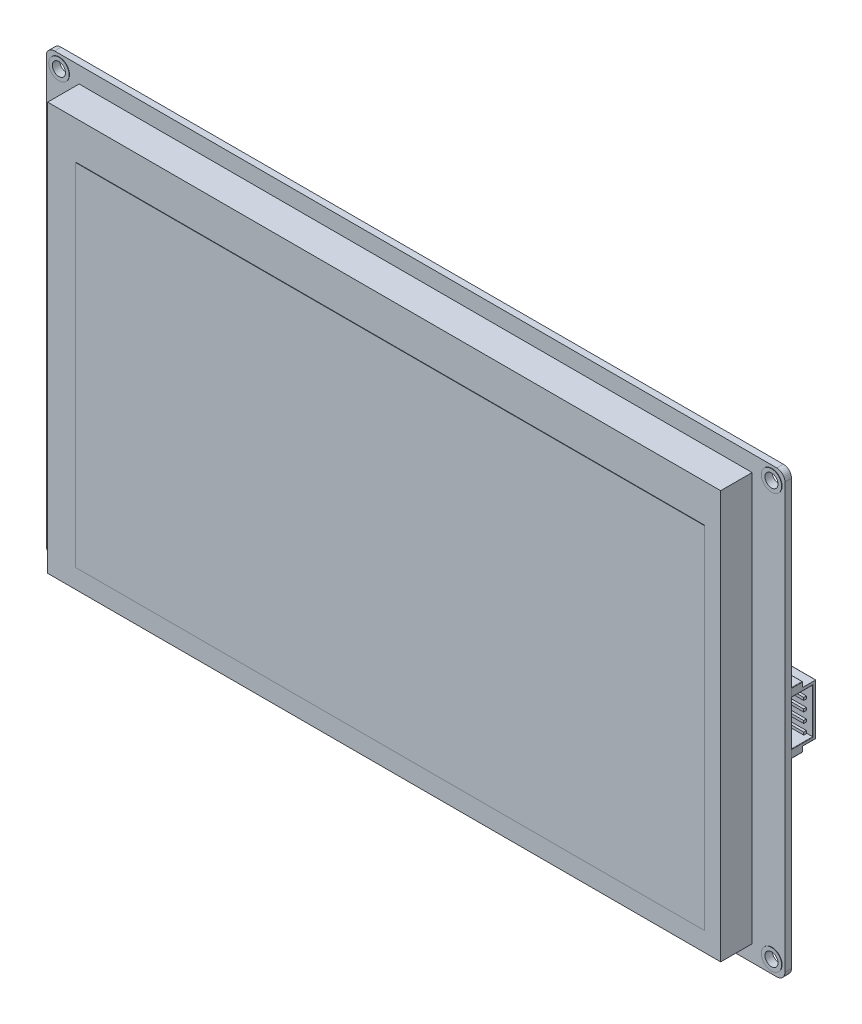
from build123d import *

# Parameters (mm, degrees)
IZIM1_W                          = 181
IZIM1_H                          = 108
Y_KSEKLIK_EKSTR_ZYON1_DEPTH      = 1.6
IZIM2_R                          = 1.6
KES_EKSTR_ZYON1_DEPTH            = 69.6
Y_KSEKLIK_EKSTR_ZYON3_DEPTH      = 0.1
Y_KSEKLIK_EKSTR_ZYON3_DEPTH_BACK = 1.7
IZIM3_R                          = 2.5
IZIM3_R_2                        = 1.6
RADYUS1_R                        = 2
IZIM4_W                          = 164.9
IZIM4_H                          = 100
Y_KSEKLIK_EKSTR_ZYON4_DEPTH      = 7.7
IZIM5_W                          = 154.08
IZIM5_H                          = 85.92
Y_KSEKLIK_EKSTR_ZYON5_DEPTH      = 0.1
IZIM9_W                          = 8.2
IZIM9_H                          = 6.25
Y_KSEKLIK_EKSTR_ZYON9_DEPTH      = 6
IZIM10_W                         = 5.25
IZIM10_H                         = 1.25
Y_KSEKLIK_EKSTR_ZYON10_DEPTH     = 2.75
KES_EKSTR_ZYON3_DEPTH            = 11.75
IZIM12_W                         = 0.504327867
IZIM12_H                         = 12.5
Y_KSEKLIK_EKSTR_ZYON11_DEPTH     = 6
Y_KSEKLIK_EKSTR_ZYON12_DEPTH     = 0.001
IZIM14_W                         = 0.65
IZIM14_H                         = 0.65
Y_KSEKLIK_EKSTR_ZYON13_DEPTH     = 7.696672133
RADYUS2_R                        = 0.1


with BuildPart() as part:
    # Çizim1 → Yükseklik-Ekstrüzyon1 (new body)
    with BuildSketch(Plane.XY):
        with Locations((90.5, -54)):
            Rectangle(IZIM1_W, IZIM1_H)
    extrude(amount=Y_KSEKLIK_EKSTR_ZYON1_DEPTH)

    # Çizim2 → Kes-Ekstrüzyon1 (cut)
    with BuildSketch(Plane.XY.offset(1.6)):
        with Locations((3.2, -3.2)):
            Circle(IZIM2_R)
        with Locations((177.8, -3.2)):
            Circle(IZIM2_R)
        with Locations((177.8, -104.8)):
            Circle(IZIM2_R)
        with Locations((3.2, -104.8)):
            Circle(IZIM2_R)
    extrude(amount=-KES_EKSTR_ZYON1_DEPTH, mode=Mode.SUBTRACT)

    # Çizim3 → Yükseklik-Ekstrüzyon3 (add, two sides: drawn at the far end of the back side and taken through both)
    # profile 1 of 4: a face of its own
    with BuildSketch(Plane.XY.offset(1.6).offset(-Y_KSEKLIK_EKSTR_ZYON3_DEPTH_BACK)):
        with Locations((3.2, -3.2)):
            Circle(IZIM3_R)
        with Locations((3.2, -3.2)):
            Circle(IZIM3_R_2, mode=Mode.SUBTRACT)
    # profile 2 of 4: a face of its own
    with BuildSketch(Plane.XY.offset(1.6).offset(-Y_KSEKLIK_EKSTR_ZYON3_DEPTH_BACK)):
        with Locations((177.8, -3.2)):
            Circle(IZIM3_R)
        with Locations((177.8, -3.2)):
            Circle(IZIM3_R_2, mode=Mode.SUBTRACT)
    # profile 3 of 4: a face of its own
    with BuildSketch(Plane.XY.offset(1.6).offset(-Y_KSEKLIK_EKSTR_ZYON3_DEPTH_BACK)):
        with Locations((3.2, -104.8)):
            Circle(IZIM3_R)
        with Locations((3.2, -104.8)):
            Circle(IZIM3_R_2, mode=Mode.SUBTRACT)
    # profile 4 of 4: a face of its own
    with BuildSketch(Plane.XY.offset(1.6).offset(-Y_KSEKLIK_EKSTR_ZYON3_DEPTH_BACK)):
        with Locations((177.8, -104.8)):
            Circle(IZIM3_R)
        with Locations((177.8, -104.8)):
            Circle(IZIM3_R_2, mode=Mode.SUBTRACT)
    extrude(amount=Y_KSEKLIK_EKSTR_ZYON3_DEPTH + Y_KSEKLIK_EKSTR_ZYON3_DEPTH_BACK)

    # Radyus1
    radyus1_edges = [part.edges().sort_by_distance(p)[0] for p in [
        (0, 0, 0.8),
        (181, 0, 0.8),
        (181, -108, 0.8),
        (0, -108, 0.8),
    ]]
    fillet(radyus1_edges, radius=RADYUS1_R)

    # Çizim4 → Yükseklik-Ekstrüzyon4 (add)
    with BuildSketch(Plane.XY.offset(1.6)):
        with Locations((90.5, -54)):
            Rectangle(IZIM4_W, IZIM4_H)
    extrude(amount=Y_KSEKLIK_EKSTR_ZYON4_DEPTH)

    # Çizim5 → Yükseklik-Ekstrüzyon5 (add)
    with BuildSketch(Plane.XY.offset(9.3)):
        with Locations((91.99, -56.26)):
            Rectangle(IZIM5_W, IZIM5_H)
    extrude(amount=Y_KSEKLIK_EKSTR_ZYON5_DEPTH)

    # Çizim9 → Yükseklik-Ekstrüzyon9 (add)
    with BuildSketch(Plane(origin=(0, 0, 0), x_dir=(-1, 0, 0), z_dir=(0, 0, -1))):
        with Locations((-176.9, -50.875)):
            Rectangle(IZIM9_W, IZIM9_H)
        with Locations((-176.9, -57.125)):
            Rectangle(IZIM9_W, IZIM9_H)
    extrude(amount=Y_KSEKLIK_EKSTR_ZYON9_DEPTH)

    # Çizim10 → Yükseklik-Ekstrüzyon10 (add)
    with BuildSketch(Plane(origin=(0, 0, 0), x_dir=(-1, 0, 0), z_dir=(0, 0, -1))):
        with Locations((-178.375, -60.875)):
            Rectangle(IZIM10_W, IZIM10_H)
        with Locations((-178.375, -47.125)):
            Rectangle(IZIM10_W, IZIM10_H)
    extrude(amount=Y_KSEKLIK_EKSTR_ZYON10_DEPTH)

    # Çizim11 → Kes-Ekstrüzyon3 (cut)
    with BuildSketch(Plane(origin=(181, 0, 0), x_dir=(0, 0, -1), z_dir=(1, 0, 0))):
        Polygon((5.25, -48.5), (0, -48.5), (0, -59.5), (2, -59.5), (5.25, -59.5), align=None)
    extrude(amount=-KES_EKSTR_ZYON3_DEPTH, mode=Mode.SUBTRACT)

    # Çizim12 → Yükseklik-Ekstrüzyon11 (add)
    with BuildSketch(Plane(origin=(0, 0, -6), x_dir=(-1, 0, 0), z_dir=(0, 0, -1))):
        with Locations((-173.052163934, -54)):
            Rectangle(IZIM12_W, IZIM12_H)
    extrude(amount=-Y_KSEKLIK_EKSTR_ZYON11_DEPTH)

    # Çizim13 → Yükseklik-Ekstrüzyon12 (add)
    with BuildSketch(Plane(origin=(181, 0, 0), x_dir=(0, 0, -1), z_dir=(1, 0, 0))):
        Polygon((0, -59.5), (0, -61.5), (2.75, -61.5), (2.75, -60.25), (6, -60.25), (6, -47.75), (2.75, -47.75), (2.75, -46.5), (0, -46.5), (0, -48.5), (5.25, -48.5), (5.25, -59.5), align=None)
    extrude(amount=Y_KSEKLIK_EKSTR_ZYON12_DEPTH)

    # Çizim14 → Yükseklik-Ekstrüzyon13 (add)
    with BuildSketch(Plane(origin=(173.304327867, 0, 0), x_dir=(0, 0, -1), z_dir=(1, 0, 0))):
        with Locations((3.325, -57.675)):
            Rectangle(IZIM14_W, IZIM14_H)
        with Locations((3.325, -55.225)):
            Rectangle(IZIM14_W, IZIM14_H)
        with Locations((3.325, -52.775)):
            Rectangle(IZIM14_W, IZIM14_H)
        with Locations((3.325, -50.325)):
            Rectangle(IZIM14_W, IZIM14_H)
    extrude(amount=Y_KSEKLIK_EKSTR_ZYON13_DEPTH)

    # Radyus2
    # the kernel refuses this fillet: 0.1 mm, written as the material it takes off along each edge
    with BuildSketch(Plane(origin=(175.85, -61.4, -2.65), x_dir=(0, 0, -1), z_dir=(-1, 0, 0))) as radyus2_piece_1_section:
        Polygon((0, 0), (RADYUS2_R * 1.02, 0), (RADYUS2_R * 1.02, RADYUS2_R * 1.02), (0, RADYUS2_R * 1.02), align=None)
    radyus2_piece_1 = extrude(amount=RADYUS2_R * 1.02, mode=Mode.PRIVATE)
    radyus2_piece_1 = radyus2_piece_1 - Plane(origin=(175.85, -61.4, -2.65), x_dir=(0, 0.7071067811865475, 0.7071067811865475), z_dir=(-1, 0, 0)) * Sphere(RADYUS2_R, mode=Mode.PRIVATE)
    add(radyus2_piece_1, mode=Mode.SUBTRACT)
    with BuildSketch(Plane(origin=(172.9, -60.15, -5.9), x_dir=(0, 0, -1), z_dir=(-1, 0, 0))) as radyus2_piece_2_section:
        Polygon((0, 0), (RADYUS2_R * 1.02, 0), (RADYUS2_R * 1.02, RADYUS2_R * 1.02), (0, RADYUS2_R * 1.02), align=None)
    radyus2_piece_2 = extrude(amount=RADYUS2_R * 1.02, mode=Mode.PRIVATE)
    radyus2_piece_2 = radyus2_piece_2 - Plane(origin=(172.9, -60.15, -5.9), x_dir=(0, 0.7071067811865475, 0.7071067811865475), z_dir=(-1, 0, 0)) * Sphere(RADYUS2_R, mode=Mode.PRIVATE)
    add(radyus2_piece_2, mode=Mode.SUBTRACT)
    with BuildSketch(Plane(origin=(172.9, -47.85, -5.9), x_dir=(-1, 0, 0), z_dir=(0, 1, 0))) as radyus2_piece_3_section:
        Polygon((0, 0), (RADYUS2_R * 1.02, 0), (RADYUS2_R * 1.02, -RADYUS2_R * 1.02), (0, -RADYUS2_R * 1.02), align=None)
    radyus2_piece_3 = extrude(amount=RADYUS2_R * 1.02, mode=Mode.PRIVATE)
    radyus2_piece_3 = radyus2_piece_3 - Plane(origin=(172.9, -47.85, -5.9), x_dir=(0.7071067811865475, 0, 0.7071067811865475), z_dir=(0, 1, 0)) * Sphere(RADYUS2_R, mode=Mode.PRIVATE)
    add(radyus2_piece_3, mode=Mode.SUBTRACT)
    with BuildSketch(Plane(origin=(175.85, -46.6, -2.65), x_dir=(-1, 0, 0), z_dir=(0, 1, 0))) as radyus2_piece_4_section:
        Polygon((0, 0), (RADYUS2_R * 1.02, 0), (RADYUS2_R * 1.02, -RADYUS2_R * 1.02), (0, -RADYUS2_R * 1.02), align=None)
    radyus2_piece_4 = extrude(amount=RADYUS2_R * 1.02, mode=Mode.PRIVATE)
    radyus2_piece_4 = radyus2_piece_4 - Plane(origin=(175.85, -46.6, -2.65), x_dir=(0.7071067811865475, 0, 0.7071067811865475), z_dir=(0, 1, 0)) * Sphere(RADYUS2_R, mode=Mode.PRIVATE)
    add(radyus2_piece_4, mode=Mode.SUBTRACT)
    with BuildSketch(Plane(origin=(181.001, -61.5, 0), x_dir=(0, 1, 0), z_dir=(0, 0, -1)), Plane(origin=(181.001, -46.5, -2.75), x_dir=(0, -1, 0), z_dir=(0, 0, 1))) as radyus2_piece_5:
        with BuildLine():
            CenterArc((RADYUS2_R, -RADYUS2_R), RADYUS2_R, 90, 90)
            Line((0, -RADYUS2_R), (-RADYUS2_R * 0.02, -RADYUS2_R))
            Line((-RADYUS2_R * 0.02, -RADYUS2_R), (-RADYUS2_R * 0.02, RADYUS2_R * 0.0200000000001))
            Line((-RADYUS2_R * 0.02, RADYUS2_R * 0.0200000000001), (RADYUS2_R, RADYUS2_R * 0.0200000000001))
            Line((RADYUS2_R, RADYUS2_R * 0.0200000000001), (RADYUS2_R, 0))
        make_face()
    extrude(amount=2.75, mode=Mode.SUBTRACT)
    with BuildSketch(Plane(origin=(181.001, -59.5, -5.25), x_dir=(0, -1, 0), z_dir=(0, 0, 1)), Plane(origin=(181.001, -48.5, 0), x_dir=(0, 1, 0), z_dir=(0, 0, -1))) as radyus2_piece_6:
        with BuildLine():
            CenterArc((RADYUS2_R, -RADYUS2_R), RADYUS2_R, 90, 90)
            Line((0, -RADYUS2_R), (-RADYUS2_R * 0.02, -RADYUS2_R))
            Line((-RADYUS2_R * 0.02, -RADYUS2_R), (-RADYUS2_R * 0.02, RADYUS2_R * 0.0200000000001))
            Line((-RADYUS2_R * 0.02, RADYUS2_R * 0.0200000000001), (RADYUS2_R, RADYUS2_R * 0.0200000000001))
            Line((RADYUS2_R, RADYUS2_R * 0.0200000000001), (RADYUS2_R, 0))
        make_face()
    extrude(amount=5.25, mode=Mode.SUBTRACT)
    with BuildSketch(Plane(origin=(175.75, -61.5, 0), x_dir=(0, 1, 0), z_dir=(0, 0, -1)), Plane(origin=(175.75, -46.5, 0), x_dir=(1, 0, 0), z_dir=(0, 0, -1))) as radyus2_piece_7:
        with BuildLine():
            CenterArc((RADYUS2_R, RADYUS2_R), RADYUS2_R, 180, 90)
            Line((0, RADYUS2_R), (-RADYUS2_R * 0.02, RADYUS2_R))
            Line((-RADYUS2_R * 0.02, RADYUS2_R), (-RADYUS2_R * 0.02, -RADYUS2_R * 0.0200000000001))
            Line((-RADYUS2_R * 0.02, -RADYUS2_R * 0.0200000000001), (RADYUS2_R, -RADYUS2_R * 0.0200000000001))
            Line((RADYUS2_R, -RADYUS2_R * 0.0200000000001), (RADYUS2_R, 0))
        make_face()
    extrude(amount=2.65, mode=Mode.SUBTRACT)
    with BuildSketch(Plane(origin=(175.85, -61.5, -2.75), x_dir=(0, 1, 0), z_dir=(1, 0, 0))) as radyus2_piece_8:
        with BuildLine():
            CenterArc((RADYUS2_R, RADYUS2_R), RADYUS2_R, 180, 90)
            Line((0, RADYUS2_R), (-RADYUS2_R * 0.02, RADYUS2_R))
            Line((-RADYUS2_R * 0.02, RADYUS2_R), (-RADYUS2_R * 0.02, -RADYUS2_R * 0.02))
            Line((-RADYUS2_R * 0.02, -RADYUS2_R * 0.02), (RADYUS2_R, -RADYUS2_R * 0.02))
            Line((RADYUS2_R, -RADYUS2_R * 0.02), (RADYUS2_R, 0))
        make_face()
    extrude(amount=5.151, mode=Mode.SUBTRACT)
    with BuildSketch(Plane(origin=(175.75, -61.4, -2.75), x_dir=(0, 0, 1), z_dir=(0, 1, 0)), Plane(origin=(175.75, -47.75, -2.75), x_dir=(0, 0, 1), z_dir=(0, 1, 0))) as radyus2_piece_9:
        with BuildLine():
            CenterArc((RADYUS2_R, RADYUS2_R), RADYUS2_R, 180, 90)
            Line((0, RADYUS2_R), (-RADYUS2_R * 0.02, RADYUS2_R))
            Line((-RADYUS2_R * 0.02, RADYUS2_R), (-RADYUS2_R * 0.02, -RADYUS2_R * 0.0200000000001))
            Line((-RADYUS2_R * 0.02, -RADYUS2_R * 0.0200000000001), (RADYUS2_R, -RADYUS2_R * 0.0200000000001))
            Line((RADYUS2_R, -RADYUS2_R * 0.0200000000001), (RADYUS2_R, 0))
        make_face()
    extrude(amount=1.15, mode=Mode.SUBTRACT)
    with BuildSketch(Plane(origin=(172.8, -60.25, 0), x_dir=(0, 1, 0), z_dir=(0, 0, -1)), Plane(origin=(172.8, -47.75, 0), x_dir=(1, 0, 0), z_dir=(0, 0, -1))) as radyus2_piece_10:
        with BuildLine():
            CenterArc((RADYUS2_R, RADYUS2_R), RADYUS2_R, 180, 90)
            Line((0, RADYUS2_R), (-RADYUS2_R * 0.02, RADYUS2_R))
            Line((-RADYUS2_R * 0.02, RADYUS2_R), (-RADYUS2_R * 0.02, -RADYUS2_R * 0.0200000000001))
            Line((-RADYUS2_R * 0.02, -RADYUS2_R * 0.0200000000001), (RADYUS2_R, -RADYUS2_R * 0.0200000000001))
            Line((RADYUS2_R, -RADYUS2_R * 0.0200000000001), (RADYUS2_R, 0))
        make_face()
    extrude(amount=5.9, mode=Mode.SUBTRACT)
    with BuildSketch(Plane(origin=(172.9, -60.25, -6), x_dir=(0, 1, 0), z_dir=(1, 0, 0))) as radyus2_piece_11:
        with BuildLine():
            CenterArc((RADYUS2_R, RADYUS2_R), RADYUS2_R, 180, 90)
            Line((0, RADYUS2_R), (-RADYUS2_R * 0.02, RADYUS2_R))
            Line((-RADYUS2_R * 0.02, RADYUS2_R), (-RADYUS2_R * 0.02, -RADYUS2_R * 0.02))
            Line((-RADYUS2_R * 0.02, -RADYUS2_R * 0.02), (RADYUS2_R, -RADYUS2_R * 0.02))
            Line((RADYUS2_R, -RADYUS2_R * 0.02), (RADYUS2_R, 0))
        make_face()
    extrude(amount=8.101, mode=Mode.SUBTRACT)
    with BuildSketch(Plane(origin=(172.8, -60.15, -6), x_dir=(0, 0, 1), z_dir=(0, 1, 0))) as radyus2_piece_12:
        with BuildLine():
            CenterArc((RADYUS2_R, RADYUS2_R), RADYUS2_R, 180, 90)
            Line((0, RADYUS2_R), (-RADYUS2_R * 0.02, RADYUS2_R))
            Line((-RADYUS2_R * 0.02, RADYUS2_R), (-RADYUS2_R * 0.02, -RADYUS2_R * 0.0200000000001))
            Line((-RADYUS2_R * 0.02, -RADYUS2_R * 0.0200000000001), (RADYUS2_R, -RADYUS2_R * 0.0200000000001))
            Line((RADYUS2_R, -RADYUS2_R * 0.0200000000001), (RADYUS2_R, 0))
        make_face()
    extrude(amount=12.3, mode=Mode.SUBTRACT)
    with BuildSketch(Plane(origin=(181.001, -47.75, -6), x_dir=(0, 0, 1), z_dir=(-1, 0, 0))) as radyus2_piece_13:
        with BuildLine():
            CenterArc((RADYUS2_R, -RADYUS2_R), RADYUS2_R, 90, 90)
            Line((0, -RADYUS2_R), (-RADYUS2_R * 0.02, -RADYUS2_R))
            Line((-RADYUS2_R * 0.02, -RADYUS2_R), (-RADYUS2_R * 0.02, RADYUS2_R * 0.02))
            Line((-RADYUS2_R * 0.02, RADYUS2_R * 0.02), (RADYUS2_R, RADYUS2_R * 0.02))
            Line((RADYUS2_R, RADYUS2_R * 0.02), (RADYUS2_R, 0))
        make_face()
    extrude(amount=8.101, mode=Mode.SUBTRACT)
    with BuildSketch(Plane(origin=(181.001, -48.5, -5.25), x_dir=(0, 0, -1), z_dir=(0, -1, 0))) as radyus2_piece_14:
        with BuildLine():
            CenterArc((RADYUS2_R, -RADYUS2_R), RADYUS2_R, 90, 90)
            Line((0, -RADYUS2_R), (-RADYUS2_R * 0.02, -RADYUS2_R))
            Line((-RADYUS2_R * 0.02, -RADYUS2_R), (-RADYUS2_R * 0.02, RADYUS2_R * 0.0200000000001))
            Line((-RADYUS2_R * 0.02, RADYUS2_R * 0.0200000000001), (RADYUS2_R, RADYUS2_R * 0.0200000000001))
            Line((RADYUS2_R, RADYUS2_R * 0.0200000000001), (RADYUS2_R, 0))
        make_face()
    extrude(amount=11, mode=Mode.SUBTRACT)
    with BuildSketch(Plane(origin=(181.001, -60.25, -6), x_dir=(0, 0, 1), z_dir=(0, 1, 0))) as radyus2_piece_15:
        with BuildLine():
            CenterArc((RADYUS2_R, -RADYUS2_R), RADYUS2_R, 90, 90)
            Line((0, -RADYUS2_R), (-RADYUS2_R * 0.02, -RADYUS2_R))
            Line((-RADYUS2_R * 0.02, -RADYUS2_R), (-RADYUS2_R * 0.02, RADYUS2_R * 0.0200000000001))
            Line((-RADYUS2_R * 0.02, RADYUS2_R * 0.0200000000001), (RADYUS2_R, RADYUS2_R * 0.0200000000001))
            Line((RADYUS2_R, RADYUS2_R * 0.0200000000001), (RADYUS2_R, 0))
        make_face()
    extrude(amount=12.5, mode=Mode.SUBTRACT)
    with BuildSketch(Plane(origin=(181.001, -46.5, -2.75), x_dir=(0, 0, 1), z_dir=(-1, 0, 0))) as radyus2_piece_16:
        with BuildLine():
            CenterArc((RADYUS2_R, -RADYUS2_R), RADYUS2_R, 90, 90)
            Line((0, -RADYUS2_R), (-RADYUS2_R * 0.02, -RADYUS2_R))
            Line((-RADYUS2_R * 0.02, -RADYUS2_R), (-RADYUS2_R * 0.02, RADYUS2_R * 0.02))
            Line((-RADYUS2_R * 0.02, RADYUS2_R * 0.02), (RADYUS2_R, RADYUS2_R * 0.02))
            Line((RADYUS2_R, RADYUS2_R * 0.02), (RADYUS2_R, 0))
        make_face()
    extrude(amount=5.151, mode=Mode.SUBTRACT)
    with BuildSketch(Plane(origin=(181.001, -61.5, 0), x_dir=(0, 1, 0), z_dir=(0, 0, -1))) as radyus2_piece_17a_section:
        with BuildLine():
            CenterArc((RADYUS2_R, -RADYUS2_R), RADYUS2_R, 90, 90)
            Line((0, -RADYUS2_R), (-RADYUS2_R * 0.02, -RADYUS2_R))
            Line((-RADYUS2_R * 0.02, -RADYUS2_R), (-RADYUS2_R * 0.02, RADYUS2_R * 0.0200000000001))
            Line((-RADYUS2_R * 0.02, RADYUS2_R * 0.0200000000001), (RADYUS2_R, RADYUS2_R * 0.0200000000001))
            Line((RADYUS2_R, RADYUS2_R * 0.0200000000001), (RADYUS2_R, 0))
        make_face()
    radyus2_piece_17a = extrude(amount=3, mode=Mode.PRIVATE)
    radyus2_piece_17a = split(radyus2_piece_17a, bisect_by=Plane(origin=(180.978360489, -61.477360489, -2.75), z_dir=(0, 0, -1)), keep=Keep.TOP, mode=Mode.PRIVATE)
    with BuildSketch(Plane(origin=(175.85, -61.5, -2.75), x_dir=(0, 1, 0), z_dir=(1, 0, 0))) as radyus2_piece_17b_section:
        with BuildLine():
            CenterArc((RADYUS2_R, RADYUS2_R), RADYUS2_R, 180, 90)
            Line((0, RADYUS2_R), (-RADYUS2_R * 0.02, RADYUS2_R))
            Line((-RADYUS2_R * 0.02, RADYUS2_R), (-RADYUS2_R * 0.02, -RADYUS2_R * 0.02))
            Line((-RADYUS2_R * 0.02, -RADYUS2_R * 0.02), (RADYUS2_R, -RADYUS2_R * 0.02))
            Line((RADYUS2_R, -RADYUS2_R * 0.02), (RADYUS2_R, 0))
        make_face()
    radyus2_piece_17b = extrude(amount=5.401, mode=Mode.PRIVATE)
    radyus2_piece_17b = split(radyus2_piece_17b, bisect_by=Plane(origin=(181.001, -61.477360489, -2.727360489), z_dir=(1, 0, 0)), keep=Keep.TOP, mode=Mode.PRIVATE)
    radyus2_piece_17 = radyus2_piece_17a & radyus2_piece_17b
    add(radyus2_piece_17, mode=Mode.SUBTRACT)
    with BuildSketch(Plane(origin=(181.001, -48.5, -5.25), x_dir=(0, 0, -1), z_dir=(0, -1, 0))) as radyus2_piece_18a_section:
        with BuildLine():
            CenterArc((RADYUS2_R, -RADYUS2_R), RADYUS2_R, 90, 90)
            Line((0, -RADYUS2_R), (-RADYUS2_R * 0.02, -RADYUS2_R))
            Line((-RADYUS2_R * 0.02, -RADYUS2_R), (-RADYUS2_R * 0.02, RADYUS2_R * 0.0200000000001))
            Line((-RADYUS2_R * 0.02, RADYUS2_R * 0.0200000000001), (RADYUS2_R, RADYUS2_R * 0.0200000000001))
            Line((RADYUS2_R, RADYUS2_R * 0.0200000000001), (RADYUS2_R, 0))
        make_face()
    radyus2_piece_18a = extrude(amount=11.25, mode=Mode.PRIVATE)
    radyus2_piece_18a = split(radyus2_piece_18a, bisect_by=Plane(origin=(180.978360489, -59.5, -5.272639511), z_dir=(0, -1, 0)), keep=Keep.TOP, mode=Mode.PRIVATE)
    with BuildSketch(Plane(origin=(181.001, -59.5, -5.5), x_dir=(0, -1, 0), z_dir=(0, 0, 1))) as radyus2_piece_18b_section:
        with BuildLine():
            CenterArc((RADYUS2_R, -RADYUS2_R), RADYUS2_R, 90, 90)
            Line((0, -RADYUS2_R), (-RADYUS2_R * 0.02, -RADYUS2_R))
            Line((-RADYUS2_R * 0.02, -RADYUS2_R), (-RADYUS2_R * 0.02, RADYUS2_R * 0.0200000000001))
            Line((-RADYUS2_R * 0.02, RADYUS2_R * 0.0200000000001), (RADYUS2_R, RADYUS2_R * 0.0200000000001))
            Line((RADYUS2_R, RADYUS2_R * 0.0200000000001), (RADYUS2_R, 0))
        make_face()
    radyus2_piece_18b = extrude(amount=5.5, mode=Mode.PRIVATE)
    radyus2_piece_18b = split(radyus2_piece_18b, bisect_by=Plane(origin=(180.978360489, -59.522639511, -5.25), z_dir=(0, 0, -1)), keep=Keep.TOP, mode=Mode.PRIVATE)
    radyus2_piece_18 = radyus2_piece_18a & radyus2_piece_18b
    add(radyus2_piece_18, mode=Mode.SUBTRACT)
    with BuildSketch(Plane(origin=(181.001, -60.5, -6), x_dir=(0, 0, 1), z_dir=(0, 1, 0))) as radyus2_piece_19a_section:
        with BuildLine():
            CenterArc((RADYUS2_R, -RADYUS2_R), RADYUS2_R, 90, 90)
            Line((0, -RADYUS2_R), (-RADYUS2_R * 0.02, -RADYUS2_R))
            Line((-RADYUS2_R * 0.02, -RADYUS2_R), (-RADYUS2_R * 0.02, RADYUS2_R * 0.0200000000001))
            Line((-RADYUS2_R * 0.02, RADYUS2_R * 0.0200000000001), (RADYUS2_R, RADYUS2_R * 0.0200000000001))
            Line((RADYUS2_R, RADYUS2_R * 0.0200000000001), (RADYUS2_R, 0))
        make_face()
    radyus2_piece_19a = extrude(amount=12.75, mode=Mode.PRIVATE)
    radyus2_piece_19a = split(radyus2_piece_19a, bisect_by=Plane(origin=(180.978360489, -60.25, -5.977360489), z_dir=(0, -1, 0)), keep=Keep.TOP, mode=Mode.PRIVATE)
    with BuildSketch(Plane(origin=(172.9, -60.25, -6), x_dir=(0, 1, 0), z_dir=(1, 0, 0))) as radyus2_piece_19b_section:
        with BuildLine():
            CenterArc((RADYUS2_R, RADYUS2_R), RADYUS2_R, 180, 90)
            Line((0, RADYUS2_R), (-RADYUS2_R * 0.02, RADYUS2_R))
            Line((-RADYUS2_R * 0.02, RADYUS2_R), (-RADYUS2_R * 0.02, -RADYUS2_R * 0.02))
            Line((-RADYUS2_R * 0.02, -RADYUS2_R * 0.02), (RADYUS2_R, -RADYUS2_R * 0.02))
            Line((RADYUS2_R, -RADYUS2_R * 0.02), (RADYUS2_R, 0))
        make_face()
    radyus2_piece_19b = extrude(amount=8.351, mode=Mode.PRIVATE)
    radyus2_piece_19b = split(radyus2_piece_19b, bisect_by=Plane(origin=(181.001, -60.227360489, -5.977360489), z_dir=(1, 0, 0)), keep=Keep.TOP, mode=Mode.PRIVATE)
    radyus2_piece_19 = radyus2_piece_19a & radyus2_piece_19b
    add(radyus2_piece_19, mode=Mode.SUBTRACT)
    with BuildSketch(Plane(origin=(181.001, -60.25, -6), x_dir=(0, 0, 1), z_dir=(0, 1, 0))) as radyus2_piece_20a_section:
        with BuildLine():
            CenterArc((RADYUS2_R, -RADYUS2_R), RADYUS2_R, 90, 90)
            Line((0, -RADYUS2_R), (-RADYUS2_R * 0.02, -RADYUS2_R))
            Line((-RADYUS2_R * 0.02, -RADYUS2_R), (-RADYUS2_R * 0.02, RADYUS2_R * 0.0200000000001))
            Line((-RADYUS2_R * 0.02, RADYUS2_R * 0.0200000000001), (RADYUS2_R, RADYUS2_R * 0.0200000000001))
            Line((RADYUS2_R, RADYUS2_R * 0.0200000000001), (RADYUS2_R, 0))
        make_face()
    radyus2_piece_20a = extrude(amount=12.75, mode=Mode.PRIVATE)
    radyus2_piece_20a = split(radyus2_piece_20a, bisect_by=Plane(origin=(180.978360489, -47.75, -5.977360489), z_dir=(0, 1, 0)), keep=Keep.TOP, mode=Mode.PRIVATE)
    with BuildSketch(Plane(origin=(181.251, -47.75, -6), x_dir=(0, 0, 1), z_dir=(-1, 0, 0))) as radyus2_piece_20b_section:
        with BuildLine():
            CenterArc((RADYUS2_R, -RADYUS2_R), RADYUS2_R, 90, 90)
            Line((0, -RADYUS2_R), (-RADYUS2_R * 0.02, -RADYUS2_R))
            Line((-RADYUS2_R * 0.02, -RADYUS2_R), (-RADYUS2_R * 0.02, RADYUS2_R * 0.02))
            Line((-RADYUS2_R * 0.02, RADYUS2_R * 0.02), (RADYUS2_R, RADYUS2_R * 0.02))
            Line((RADYUS2_R, RADYUS2_R * 0.02), (RADYUS2_R, 0))
        make_face()
    radyus2_piece_20b = extrude(amount=8.351, mode=Mode.PRIVATE)
    radyus2_piece_20b = split(radyus2_piece_20b, bisect_by=Plane(origin=(181.001, -47.772639511, -5.977360489), z_dir=(1, 0, 0)), keep=Keep.TOP, mode=Mode.PRIVATE)
    radyus2_piece_20 = radyus2_piece_20a & radyus2_piece_20b
    add(radyus2_piece_20, mode=Mode.SUBTRACT)
    with BuildSketch(Plane(origin=(181.001, -48.5, 0), x_dir=(0, 1, 0), z_dir=(0, 0, -1))) as radyus2_piece_21a_section:
        with BuildLine():
            CenterArc((RADYUS2_R, -RADYUS2_R), RADYUS2_R, 90, 90)
            Line((0, -RADYUS2_R), (-RADYUS2_R * 0.02, -RADYUS2_R))
            Line((-RADYUS2_R * 0.02, -RADYUS2_R), (-RADYUS2_R * 0.02, RADYUS2_R * 0.0200000000001))
            Line((-RADYUS2_R * 0.02, RADYUS2_R * 0.0200000000001), (RADYUS2_R, RADYUS2_R * 0.0200000000001))
            Line((RADYUS2_R, RADYUS2_R * 0.0200000000001), (RADYUS2_R, 0))
        make_face()
    radyus2_piece_21a = extrude(amount=5.5, mode=Mode.PRIVATE)
    radyus2_piece_21a = split(radyus2_piece_21a, bisect_by=Plane(origin=(180.978360489, -48.477360489, -5.25), z_dir=(0, 0, -1)), keep=Keep.TOP, mode=Mode.PRIVATE)
    with BuildSketch(Plane(origin=(181.001, -48.25, -5.25), x_dir=(0, 0, -1), z_dir=(0, -1, 0))) as radyus2_piece_21b_section:
        with BuildLine():
            CenterArc((RADYUS2_R, -RADYUS2_R), RADYUS2_R, 90, 90)
            Line((0, -RADYUS2_R), (-RADYUS2_R * 0.02, -RADYUS2_R))
            Line((-RADYUS2_R * 0.02, -RADYUS2_R), (-RADYUS2_R * 0.02, RADYUS2_R * 0.0200000000001))
            Line((-RADYUS2_R * 0.02, RADYUS2_R * 0.0200000000001), (RADYUS2_R, RADYUS2_R * 0.0200000000001))
            Line((RADYUS2_R, RADYUS2_R * 0.0200000000001), (RADYUS2_R, 0))
        make_face()
    radyus2_piece_21b = extrude(amount=11.25, mode=Mode.PRIVATE)
    radyus2_piece_21b = split(radyus2_piece_21b, bisect_by=Plane(origin=(180.978360489, -48.5, -5.272639511), z_dir=(0, 1, 0)), keep=Keep.TOP, mode=Mode.PRIVATE)
    radyus2_piece_21 = radyus2_piece_21a & radyus2_piece_21b
    add(radyus2_piece_21, mode=Mode.SUBTRACT)
    with BuildSketch(Plane(origin=(181.001, -46.5, -3), x_dir=(0, -1, 0), z_dir=(0, 0, 1))) as radyus2_piece_22a_section:
        with BuildLine():
            CenterArc((RADYUS2_R, -RADYUS2_R), RADYUS2_R, 90, 90)
            Line((0, -RADYUS2_R), (-RADYUS2_R * 0.02, -RADYUS2_R))
            Line((-RADYUS2_R * 0.02, -RADYUS2_R), (-RADYUS2_R * 0.02, RADYUS2_R * 0.0200000000001))
            Line((-RADYUS2_R * 0.02, RADYUS2_R * 0.0200000000001), (RADYUS2_R, RADYUS2_R * 0.0200000000001))
            Line((RADYUS2_R, RADYUS2_R * 0.0200000000001), (RADYUS2_R, 0))
        make_face()
    radyus2_piece_22a = extrude(amount=3, mode=Mode.PRIVATE)
    radyus2_piece_22a = split(radyus2_piece_22a, bisect_by=Plane(origin=(180.978360489, -46.522639511, -2.75), z_dir=(0, 0, -1)), keep=Keep.TOP, mode=Mode.PRIVATE)
    with BuildSketch(Plane(origin=(181.251, -46.5, -2.75), x_dir=(0, 0, 1), z_dir=(-1, 0, 0))) as radyus2_piece_22b_section:
        with BuildLine():
            CenterArc((RADYUS2_R, -RADYUS2_R), RADYUS2_R, 90, 90)
            Line((0, -RADYUS2_R), (-RADYUS2_R * 0.02, -RADYUS2_R))
            Line((-RADYUS2_R * 0.02, -RADYUS2_R), (-RADYUS2_R * 0.02, RADYUS2_R * 0.02))
            Line((-RADYUS2_R * 0.02, RADYUS2_R * 0.02), (RADYUS2_R, RADYUS2_R * 0.02))
            Line((RADYUS2_R, RADYUS2_R * 0.02), (RADYUS2_R, 0))
        make_face()
    radyus2_piece_22b = extrude(amount=5.401, mode=Mode.PRIVATE)
    radyus2_piece_22b = split(radyus2_piece_22b, bisect_by=Plane(origin=(181.001, -46.522639511, -2.727360489), z_dir=(1, 0, 0)), keep=Keep.TOP, mode=Mode.PRIVATE)
    radyus2_piece_22 = radyus2_piece_22a & radyus2_piece_22b
    add(radyus2_piece_22, mode=Mode.SUBTRACT)
    # the kernel refuses this fillet: 0.1 mm, written as the material it adds along each edge
    with BuildSketch(Plane(origin=(175.75, -60.25, 0), x_dir=(-1, 0, 0), z_dir=(0, 0, -1))) as radyus2_2_piece_1:
        with BuildLine():
            CenterArc((RADYUS2_R, -RADYUS2_R), RADYUS2_R, 90, 90)
            Line((0, -RADYUS2_R), (-RADYUS2_R * 0.0200000000001, -RADYUS2_R))
            Line((-RADYUS2_R * 0.0200000000001, -RADYUS2_R), (-RADYUS2_R * 0.0200000000001, RADYUS2_R * 0.02))
            Line((-RADYUS2_R * 0.0200000000001, RADYUS2_R * 0.02), (RADYUS2_R, RADYUS2_R * 0.02))
            Line((RADYUS2_R, RADYUS2_R * 0.02), (RADYUS2_R, 0))
        make_face()
    extrude(amount=2.65)
    with BuildSketch(Plane(origin=(181.001, -60.25, -2.75), x_dir=(0, 0, -1), z_dir=(-1, 0, 0)), Plane(origin=(175.85, -47.75, -2.75), x_dir=(0, 0, -1), z_dir=(1, 0, 0))) as radyus2_2_piece_2:
        with BuildLine():
            CenterArc((RADYUS2_R, RADYUS2_R), RADYUS2_R, 180, 90)
            Line((0, RADYUS2_R), (-RADYUS2_R * 0.02, RADYUS2_R))
            Line((-RADYUS2_R * 0.02, RADYUS2_R), (-RADYUS2_R * 0.02, -RADYUS2_R * 0.02))
            Line((-RADYUS2_R * 0.02, -RADYUS2_R * 0.02), (RADYUS2_R, -RADYUS2_R * 0.02))
            Line((RADYUS2_R, -RADYUS2_R * 0.02), (RADYUS2_R, 0))
        make_face()
    extrude(amount=5.151)
    with BuildSketch(Plane(origin=(175.75, -47.75, 0), x_dir=(-1, 0, 0), z_dir=(0, 0, -1))) as radyus2_2_piece_3:
        with BuildLine():
            CenterArc((RADYUS2_R, RADYUS2_R), RADYUS2_R, 180, 90)
            Line((0, RADYUS2_R), (-RADYUS2_R * 0.0200000000001, RADYUS2_R))
            Line((-RADYUS2_R * 0.0200000000001, RADYUS2_R), (-RADYUS2_R * 0.0200000000001, -RADYUS2_R * 0.02))
            Line((-RADYUS2_R * 0.0200000000001, -RADYUS2_R * 0.02), (RADYUS2_R, -RADYUS2_R * 0.02))
            Line((RADYUS2_R, -RADYUS2_R * 0.02), (RADYUS2_R, 0))
        make_face()
    extrude(amount=2.65)
    with BuildSketch(Plane(origin=(175.85, -47.75, -2.65), x_dir=(-1, 0, 0), z_dir=(0, 0, 1))) as radyus2_2_piece_4:
        with BuildLine():
            CenterArc((0.1 + RADYUS2_R, -RADYUS2_R), RADYUS2_R, 90, 90)
            Line((0.1 + RADYUS2_R, 0), (0.1 + RADYUS2_R, RADYUS2_R * 0.02))
            Line((0.1 + RADYUS2_R, RADYUS2_R * 0.02), (0.1 - RADYUS2_R * 0.0200000000001, RADYUS2_R * 0.02))
            Line((0.1 - RADYUS2_R * 0.0200000000001, RADYUS2_R * 0.02), (0.1 - RADYUS2_R * 0.0200000000001, -RADYUS2_R))
            Line((0.1 - RADYUS2_R * 0.0200000000001, -RADYUS2_R), (0.1, -RADYUS2_R))
        make_face()
    revolve(axis=Axis((175.85, -47.75, -2.65), (0, -1, 0)), revolution_arc=90)
    with BuildSketch(Plane(origin=(175.85, -60.25, -2.65), x_dir=(-1, 0, 0), z_dir=(0, 0, 1))) as radyus2_2_piece_5:
        with BuildLine():
            CenterArc((0.1 + RADYUS2_R, RADYUS2_R), RADYUS2_R, 180, 90)
            Line((0.1, RADYUS2_R), (0.1 - RADYUS2_R * 0.0200000000001, RADYUS2_R))
            Line((0.1 - RADYUS2_R * 0.0200000000001, RADYUS2_R), (0.1 - RADYUS2_R * 0.0200000000001, -RADYUS2_R * 0.02))
            Line((0.1 - RADYUS2_R * 0.0200000000001, -RADYUS2_R * 0.02), (0.1 + RADYUS2_R, -RADYUS2_R * 0.02))
            Line((0.1 + RADYUS2_R, -RADYUS2_R * 0.02), (0.1 + RADYUS2_R, 0))
        make_face()
    revolve(axis=Axis((175.85, -60.25, -2.65), (0, -1, 0)), revolution_arc=90)
    # the kernel refuses this fillet: 0.1 mm, written as the material it takes off along each edge
    with BuildSketch(Plane(origin=(180.901, -60.15, -5.9), x_dir=(1, 0, 0), z_dir=(0, -1, 0))) as radyus2_3_piece_1_section:
        Polygon((0, 0), (RADYUS2_R * 1.02, 0), (RADYUS2_R * 1.02, -RADYUS2_R * 1.02), (0, -RADYUS2_R * 1.02), align=None)
    radyus2_3_piece_1 = extrude(amount=RADYUS2_R * 1.02, mode=Mode.PRIVATE)
    radyus2_3_piece_1 = radyus2_3_piece_1 - Plane(origin=(180.901, -60.15, -5.9), x_dir=(-0.7071067811865475, 0, 0.7071067811865475), z_dir=(0, -1, 0)) * Sphere(RADYUS2_R, mode=Mode.PRIVATE)
    add(radyus2_3_piece_1, mode=Mode.SUBTRACT)
    with BuildSketch(Plane(origin=(180.901, -61.4, -2.65), x_dir=(0, 0, -1), z_dir=(1, 0, 0))) as radyus2_3_piece_2_section:
        Polygon((0, 0), (RADYUS2_R * 1.02, 0), (RADYUS2_R * 1.02, -RADYUS2_R * 1.02), (0, -RADYUS2_R * 1.02), align=None)
    radyus2_3_piece_2 = extrude(amount=RADYUS2_R * 1.02, mode=Mode.PRIVATE)
    radyus2_3_piece_2 = radyus2_3_piece_2 - Plane(origin=(180.901, -61.4, -2.65), x_dir=(0, 0.7071067811865475, 0.7071067811865475), z_dir=(1, 0, 0)) * Sphere(RADYUS2_R, mode=Mode.PRIVATE)
    add(radyus2_3_piece_2, mode=Mode.SUBTRACT)
    with BuildSketch(Plane(origin=(181.001, -61.4, -2.75), x_dir=(0, 0, 1), z_dir=(0, 1, 0))) as radyus2_3_piece_3:
        with BuildLine():
            CenterArc((RADYUS2_R, -RADYUS2_R), RADYUS2_R, 90, 90)
            Line((0, -RADYUS2_R), (-RADYUS2_R * 0.02, -RADYUS2_R))
            Line((-RADYUS2_R * 0.02, -RADYUS2_R), (-RADYUS2_R * 0.02, RADYUS2_R * 0.0200000000001))
            Line((-RADYUS2_R * 0.02, RADYUS2_R * 0.0200000000001), (RADYUS2_R, RADYUS2_R * 0.0200000000001))
            Line((RADYUS2_R, RADYUS2_R * 0.0200000000001), (RADYUS2_R, 0))
        make_face()
    extrude(amount=1.05, mode=Mode.SUBTRACT)
    with BuildSketch(Plane(origin=(181.001, -60.25, -2.85), x_dir=(-1, 0, 0), z_dir=(0, 0, -1))) as radyus2_3_piece_4:
        with BuildLine():
            CenterArc((RADYUS2_R, RADYUS2_R), RADYUS2_R, 180, 90)
            Line((0, RADYUS2_R), (-RADYUS2_R * 0.0200000000001, RADYUS2_R))
            Line((-RADYUS2_R * 0.0200000000001, RADYUS2_R), (-RADYUS2_R * 0.0200000000001, -RADYUS2_R * 0.02))
            Line((-RADYUS2_R * 0.0200000000001, -RADYUS2_R * 0.02), (RADYUS2_R, -RADYUS2_R * 0.02))
            Line((RADYUS2_R, -RADYUS2_R * 0.02), (RADYUS2_R, 0))
        make_face()
    extrude(amount=3.05, mode=Mode.SUBTRACT)
    with BuildSketch(Plane(origin=(181.001, -60.35, -2.85), x_dir=(0, 1, 0), z_dir=(0, 0, -1))) as radyus2_3_piece_5:
        with BuildLine():
            CenterArc((0.1 + RADYUS2_R, -RADYUS2_R), RADYUS2_R, 90, 90)
            Line((0.1, -RADYUS2_R), (0.1 - RADYUS2_R * 0.02, -RADYUS2_R))
            Line((0.1 - RADYUS2_R * 0.02, -RADYUS2_R), (0.1 - RADYUS2_R * 0.02, RADYUS2_R * 0.0200000000001))
            Line((0.1 - RADYUS2_R * 0.02, RADYUS2_R * 0.0200000000001), (0.1 + RADYUS2_R, RADYUS2_R * 0.0200000000001))
            Line((0.1 + RADYUS2_R, RADYUS2_R * 0.0200000000001), (0.1 + RADYUS2_R, 0))
        make_face()
    revolve(axis=Axis((181.001, -60.35, -2.85), (1, 0, 0)), revolution_arc=90, mode=Mode.SUBTRACT)


solid = part.part
